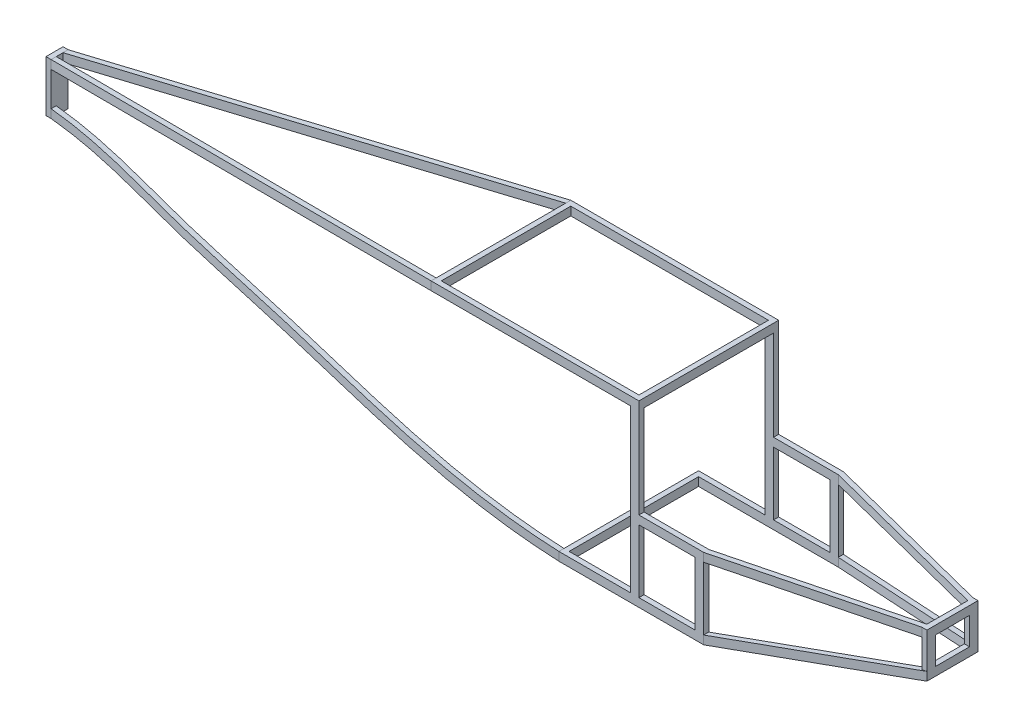
from build123d import *

# Parameters (mm, degrees)
SKETCH1_W                 = 610
SKETCH1_H                 = 410
SKETCH1_W_2               = 580
SKETCH1_H_2               = 380
BOSS_EXTRUDE1_DEPTH       = 25
BOSS_EXTRUDE2_DEPTH       = 15
BOSS_EXTRUDE6_DEPTH       = 15
BOSS_EXTRUDE11_DEPTH      = 25
SKETCH8_W                 = 15
SKETCH8_H                 = 130
BOSS_EXTRUDE12_DEPTH      = 25
SKETCH9_W                 = 15
SKETCH9_H                 = 130
BOSS_EXTRUDE13_DEPTH      = 25
SKETCH10_W                = 150
SKETCH10_H                = 25
BOSS_EXTRUDE14_DEPTH      = 15
SKETCH13_W                = 215
SKETCH13_H                = 25
BOSS_EXTRUDE15_DEPTH      = 15
SKETCH14_W                = 215
SKETCH14_H                = 25
BOSS_EXTRUDE16_DEPTH      = 15
BOSS_EXTRUDE17_DEPTH      = 25
BOSS_EXTRUDE17_DEPTH_BACK = 25
BOSS_EXTRUDE17_START      = -205
SKETCH17_W                = 15
SKETCH17_H                = 150
BOSS_EXTRUDE18_DEPTH      = 25
LOFT13_START              = -525.0000001
LOFT13_DEPTH              = 225.0000002
LOFT13_START_2            = -152.5000001
LOFT13_2_DEPTH            = 415.5000001


with BuildPart() as part:
    # Sketch1 → Boss-Extrude1 (new body)
    with BuildSketch(Plane(origin=(0, 0, 0), x_dir=(1, 0, 0), z_dir=(0, 1, 0))):
        with Locations((695.4, -52.5)):
            Rectangle(SKETCH1_W, SKETCH1_H)
        with Locations((695.4, -52.5)):
            Rectangle(SKETCH1_W_2, SKETCH1_H_2, mode=Mode.SUBTRACT)
    extrude(amount=-BOSS_EXTRUDE1_DEPTH)

    # Sketch2 → Boss-Extrude2 (add)
    with BuildSketch(Plane.XY.offset(257.5)):
        Polygon((1000.4, 0), (1000.4, -290), (1190.4, -290), (1190.4, -500), (1165.4, -500), (1165.4, -315), (1000.4, -315), (1000.4, -500), (975.4, -500), (975.4, 0), align=None)
    extrude(amount=-BOSS_EXTRUDE2_DEPTH)

    # Sketch4 → Boss-Extrude6 (add)
    with BuildSketch(Plane(origin=(0, 0, -152.5), x_dir=(-1, 0, 0), z_dir=(0, 0, -1))):
        Polygon((-1000.4, -500), (-1000.4, -315), (-1165.4, -315), (-1165.4, -500), (-1190.4, -500), (-1190.4, -290), (-1000.4, -290), (-1000.4, 0), (-975.4, 0), (-975.4, -500), align=None)
    extrude(amount=-BOSS_EXTRUDE6_DEPTH)

    # Sketch6 → Boss-Extrude11 (add)
    with BuildSketch(Plane(origin=(0, -290, 0), x_dir=(1, 0, 0), z_dir=(0, 1, 0))):
        Polygon((1700.4, 22.5), (1715.4, 22.5), (1715.4, -52.5), (1715.4, -127.5), (1700.4, -127.5), (1190.4, -257.5), (1190.4, -242.5), (1700.4, -112.5), (1700.4, 7.5), (1190.4, 137.5), (1190.4, 152.5), align=None)
    extrude(amount=-BOSS_EXTRUDE11_DEPTH)

    # Sketch8 → Boss-Extrude12 (add)
    with BuildSketch(Plane.XY.offset(127.5)):
        with Locations((1707.9, -355)):
            Rectangle(SKETCH8_W, SKETCH8_H)
    extrude(amount=-BOSS_EXTRUDE12_DEPTH)

    # Sketch9 → Boss-Extrude13 (add)
    with BuildSketch(Plane(origin=(0, 0, -22.5), x_dir=(-1, 0, 0), z_dir=(0, 0, -1))):
        with Locations((-1707.9, -355)):
            Rectangle(SKETCH9_W, SKETCH9_H)
    extrude(amount=-BOSS_EXTRUDE13_DEPTH)

    # Sketch10 → Boss-Extrude14 (add)
    with BuildSketch(Plane.ZY.offset(-1700.4)):
        with Locations((52.5, -407.5)):
            Rectangle(SKETCH10_W, SKETCH10_H)
    extrude(amount=-BOSS_EXTRUDE14_DEPTH)

    # Sketch13 → Boss-Extrude15 (add)
    with BuildSketch(Plane(origin=(0, 0, -152.5), x_dir=(-1, 0, 0), z_dir=(0, 0, -1))):
        with Locations((-1082.9, -512.5)):
            Rectangle(SKETCH13_W, SKETCH13_H)
    extrude(amount=-BOSS_EXTRUDE15_DEPTH)

    # Sketch14 → Boss-Extrude16 (add)
    with BuildSketch(Plane.XY.offset(257.5)):
        with Locations((1082.9, -512.5)):
            Rectangle(SKETCH14_W, SKETCH14_H)
    extrude(amount=-BOSS_EXTRUDE16_DEPTH)

    # Sketch12 → Loft2 section 0
    with BuildSketch(Plane(origin=(1715.4, 0, 0), x_dir=(0, 0, -1), z_dir=(1, 0, 0))):
        with BuildLine():
            Line((22.5, -420), (22.5, -395))
            Line((22.5, -395), (7.5, -395))
            Line((7.5, -395), (7.5, -420))
            Line((7.5, -420), (22.5, -420))
        make_face()
    # Sketch15 → Loft2 section 1
    with BuildSketch(Plane(origin=(1190.4, 0, 0), x_dir=(0, 0, -1), z_dir=(1, 0, 0))):
        with BuildLine():
            Line((152.5, -525), (137.5, -525))
            Line((137.5, -525), (137.5, -500))
            Line((137.5, -500), (152.5, -500))
            Line((152.5, -500), (152.5, -525))
        make_face()
    loft()

    # Sketch18 → Loft3 section 0
    with BuildSketch(Plane(origin=(1715.4, 0, 0), x_dir=(0, 0, -1), z_dir=(1, 0, 0))):
        with BuildLine():
            Line((-127.5, -420), (-112.5, -420))
            Line((-112.5, -420), (-112.5, -395))
            Line((-112.5, -395), (-127.5, -395))
            Line((-127.5, -395), (-127.5, -420))
        make_face()
    # Sketch19 → Loft3 section 1
    with BuildSketch(Plane(origin=(1190.4, 0, 0), x_dir=(0, 0, -1), z_dir=(1, 0, 0))):
        with BuildLine():
            Line((-257.5, -525), (-242.5, -525))
            Line((-242.5, -525), (-242.5, -500))
            Line((-242.5, -500), (-257.5, -500))
            Line((-257.5, -500), (-257.5, -525))
        make_face()
    loft()



with BuildPart() as body_2:
    # Sketch17 → Boss-Extrude17 (new, two sides: drawn at the far end of the back side and taken through both)
    with BuildSketch(Plane.XY.offset(257.5).offset(BOSS_EXTRUDE17_START - BOSS_EXTRUDE17_DEPTH_BACK)):
        with Locations((-912.1, -250)):
            Rectangle(SKETCH17_W, SKETCH17_H)
    extrude(amount=BOSS_EXTRUDE17_DEPTH + BOSS_EXTRUDE17_DEPTH_BACK)


with BuildPart() as part_1:
    add(part.part)

    add(body_2.part)  # Loft6 merges body 2
    # Sketch21 → Loft6 section 0
    with BuildSketch(Plane(origin=(-904.6, 0, 0), x_dir=(0, 0, -1), z_dir=(1, 0, 0))):
        with BuildLine():
            Line((-77.5, -175), (-62.5, -175))
            Line((-62.5, -175), (-62.5, -200))
            Line((-62.5, -200), (-77.5, -200))
            Line((-77.5, -200), (-77.5, -175))
        make_face()
    # Sketch20 → Loft6 section 1
    with BuildSketch(Plane.ZY.offset(-390.4)):
        with BuildLine():
            Line((257.5, 0), (257.5, -25))
            Line((257.5, -25), (242.5, -25))
            Line((242.5, -25), (242.5, 0))
            Line((242.5, 0), (257.5, 0))
        make_face()
    loft()

    # Sketch23 → Loft7 section 0
    with BuildSketch(Plane.ZY.offset(-390.4)):
        with BuildLine():
            Line((-152.5, 0), (-137.5, 0))
            Line((-137.5, 0), (-137.5, -25))
            Line((-137.5, -25), (-152.5, -25))
            Line((-152.5, -25), (-152.5, 0))
        make_face()
    # Sketch22 → Loft7 section 1
    with BuildSketch(Plane(origin=(-904.6, 0, 0), x_dir=(0, 0, -1), z_dir=(1, 0, 0))):
        with BuildLine():
            Line((-27.5, -175), (-27.5, -200))
            Line((-27.5, -200), (-42.5, -200))
            Line((-42.5, -200), (-42.5, -175))
            Line((-42.5, -175), (-27.5, -175))
        make_face()
    loft()

    # Sketch24 → Boss-Extrude18 (add)
    with BuildSketch(Plane.XZ.offset(525)):
        Polygon((975.4, 257.5), (765.4, 257.5), (765.4, -152.5), (975.4, -152.5), (975.4, -137.5), (780.4, -137.5), (780.4, 242.5), (975.4, 242.5), align=None)
    extrude(amount=-BOSS_EXTRUDE18_DEPTH)

    # Loft13: read off the stored shape, not the designer's step
    # Loft13 outline → Loft13 (add)
    with BuildSketch(Plane(origin=(0, 0, 0), x_dir=(1, 0, 0), z_dir=(0, 1, 0)).offset(LOFT13_START)):
        with BuildLine():
            Line((-904.6, -62.5), (-904.6, -77.5))
            add(Edge.make_bspline(
                [(-904.6, -77.5), (-764.041130949, -75.679060612), (-527.584659858, -129.428121998), (-157.569765668, -171.662088503), (257.177772802, -240.107254931), (577.127812515, -271.097379608), (765.4, -257.5)],
                knots=[0, 0, 0, 0, 0.250527251, 0.428009069, 0.664938737, 1, 1, 1, 1], degree=3))
            Line((765.4, -257.5), (765.4, -242.5))
            add(Edge.make_bspline(
                [(-904.6, -62.5), (-764.041130949, -60.679060612), (-527.584659858, -114.428121998), (-157.569765668, -156.662088503), (257.177772802, -225.107254931), (577.127812515, -256.097379608), (765.4, -242.5)],
                knots=[0, 0, 0, 0, 0.250527251, 0.428009069, 0.664938737, 1, 1, 1, 1], degree=3))
        make_face()
    extrude(amount=LOFT13_DEPTH)

    # Loft13 2 outline → Loft13 2 (cut)
    with BuildSketch(Plane.XY.offset(LOFT13_START_2)):
        Polygon((-904.6, -300), (765.4, -500), (765.4, -299.9999999), align=None)
        Polygon((765.4, -525), (-904.6, -325), (-904.6, -525.0000001), align=None)
    extrude(amount=LOFT13_2_DEPTH, mode=Mode.SUBTRACT)


solid = part_1.part
